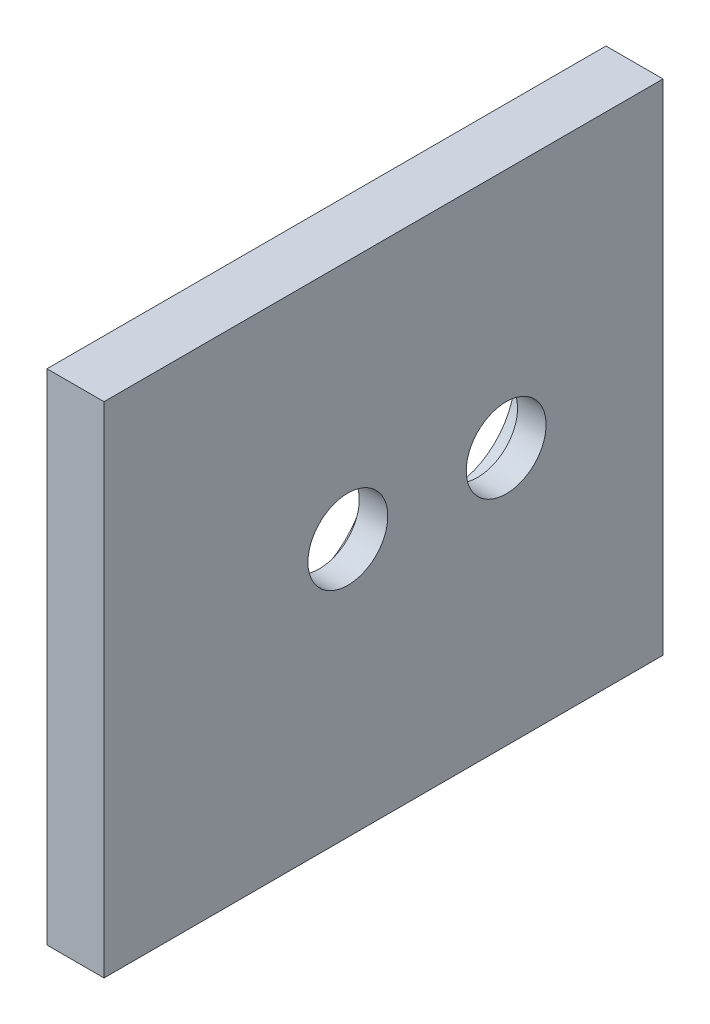
from build123d import *

# Parameters (mm, degrees)
SKETCH1_W           = 20
SKETCH1_H           = 196
BOSS_EXTRUDE1_DEPTH = 175
SKETCH2_R           = 27.5
SKETCH2_R_2         = 23
CUT_EXTRUDE1_DEPTH  = 10
SKETCH3_R           = 14
CUT_EXTRUDE2_DEPTH  = 201.820815654


with BuildPart() as part:
    # Sketch1 → Boss-Extrude1 (new body)
    with BuildSketch(Plane(origin=(114, 0, 0), x_dir=(1, 0, 0), z_dir=(0, 1, 0))):
        with Locations((-114, 0)):
            Rectangle(SKETCH1_W, SKETCH1_H)
    extrude(amount=BOSS_EXTRUDE1_DEPTH)

    # Sketch2 → Cut-Extrude1 (cut)
    with BuildSketch(Plane.ZY.offset(10)):
        with Locations((12.5, 90.5)):
            Circle(SKETCH2_R)
        with Locations((-43, 90.5)):
            Circle(SKETCH2_R_2)
    extrude(amount=-CUT_EXTRUDE1_DEPTH, mode=Mode.SUBTRACT)

    # Sketch3 → Cut-Extrude2 (cut, through all)
    with BuildSketch(Plane.ZY):
        with Locations((12.5, 90.5)):
            Circle(SKETCH3_R)
        with Locations((-43, 90.5)):
            Circle(SKETCH3_R)
    extrude(amount=-CUT_EXTRUDE2_DEPTH, mode=Mode.SUBTRACT)


solid = part.part
